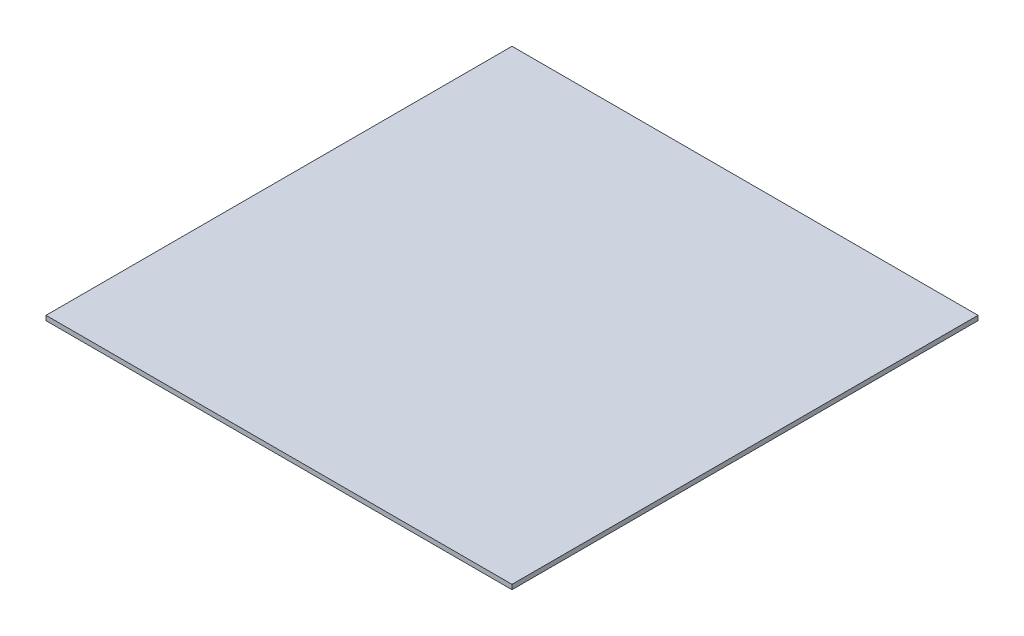
from build123d import *

# Parameters (mm, degrees)
SZKIC1_W                    = 10000
SZKIC1_H                    = 10000
DODANIE_WYCI_GNI_CIE1_DEPTH = 100


with BuildPart() as part:
    # Szkic1 → Dodanie-wyciągnięcie1 (new body)
    with BuildSketch(Plane(origin=(0, 0, 0), x_dir=(1, 0, 0), z_dir=(0, 1, 0))):
        Rectangle(SZKIC1_W, SZKIC1_H)
    extrude(amount=DODANIE_WYCI_GNI_CIE1_DEPTH)


solid = part.part
